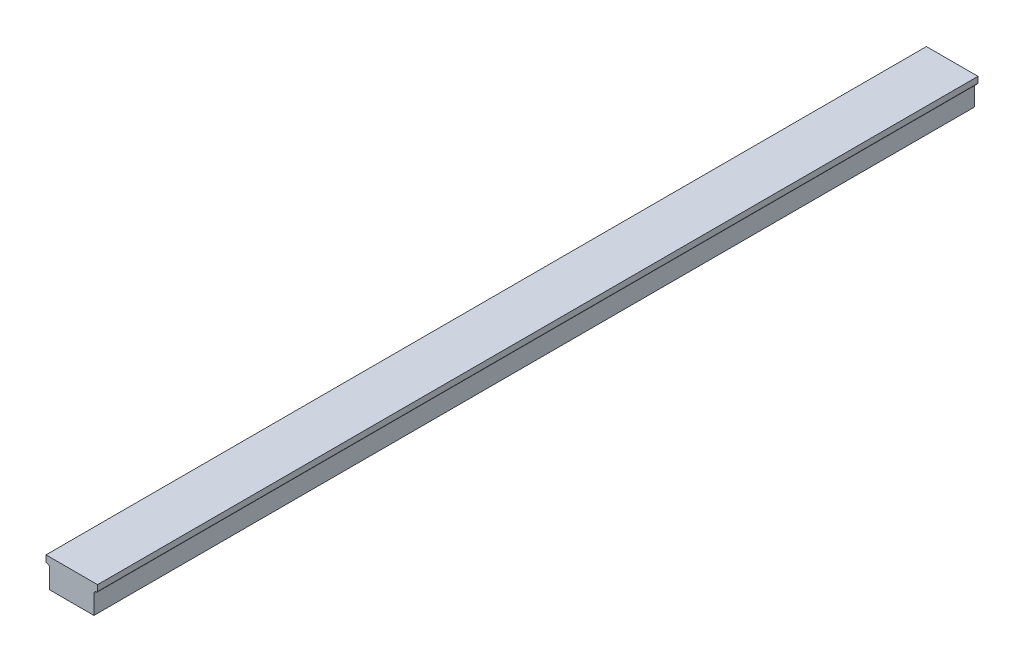
from build123d import *

# Parameters (mm, degrees)
BOSS_EXTRUDE1_DEPTH = 194.633333333
FILLET1_R           = 0.6
FILLET2_R           = 0.2


with BuildPart() as part:
    # Sketch1 → Boss-Extrude1 (new body)
    with BuildSketch(Plane.XY):
        Polygon((-5.7, 3.9), (5.7, 3.9), (5.7, 2.4), (4.9, 2.4), (4.9, -2.4), (-4.9, -2.4), (-4.9, 2.4), (-5.7, 2.4), align=None)
    extrude(amount=BOSS_EXTRUDE1_DEPTH)

    # Fillet1
    fillet1_edges = [part.edges().sort_by_distance(p)[0] for p in [
        (-4.9, 2.4, 97.316666667),
        (4.9, 2.4, 97.316666667),
    ]]
    fillet(fillet1_edges, radius=FILLET1_R)

    # Fillet2
    fillet2_edges = [part.edges().sort_by_distance(p)[0] for p in [
        (-5.7, 2.4, 97.316666667),
        (5.7, 2.4, 97.316666667),
    ]]
    fillet(fillet2_edges, radius=FILLET2_R - 0.0001)  # a hair under: the kernel refuses the full size


solid = part.part
